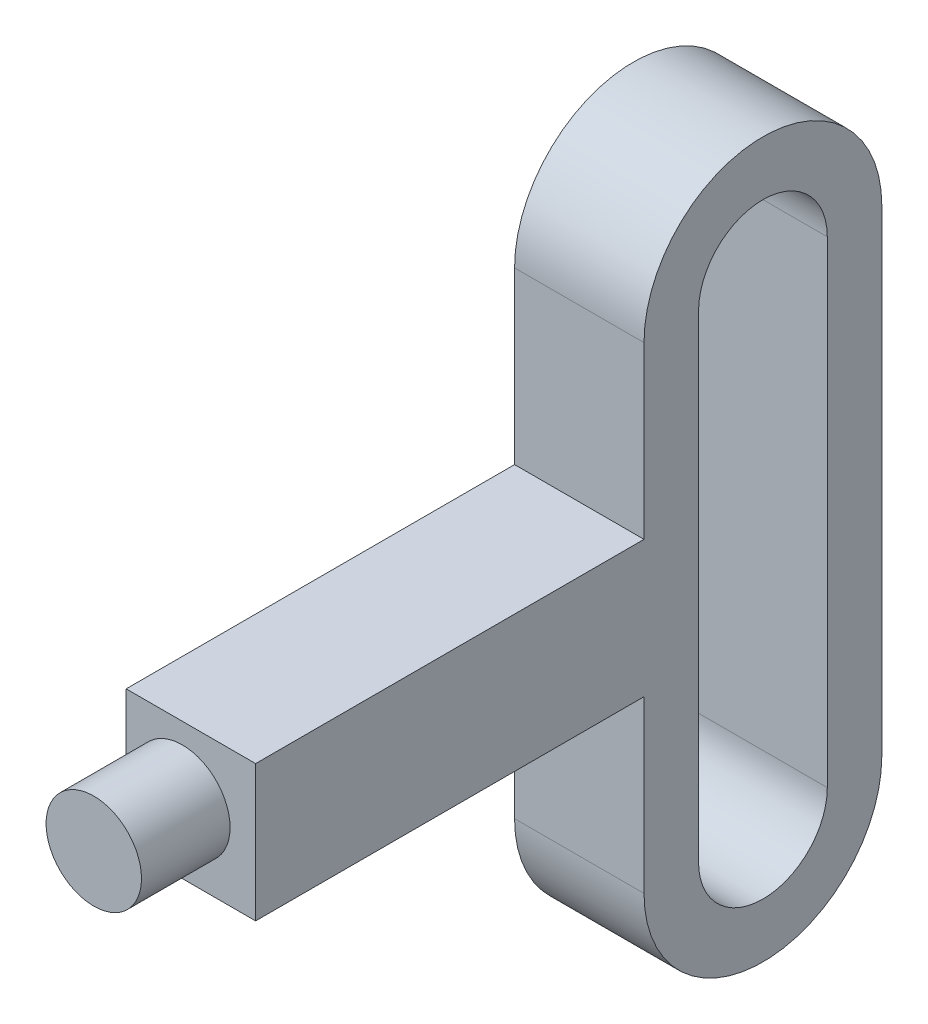
from build123d import *

# Parameters (mm, degrees)
BOSS_EXTRUDE2_DEPTH = 24.13
SKETCH3_W           = 24.13
SKETCH3_H           = 25.4
SKETCH3_R           = 8.89
CUT_EXTRUDE3_DEPTH  = 16.51


with BuildPart() as part:
    # Sketch2 → Boss-Extrude2 (new body)
    with BuildSketch(Plane(origin=(0, 0, 0), x_dir=(0, 0, -1), z_dir=(1, 0, 0))):
        with BuildLine():
            Line((-22.16, -12.7), (-22.16, -44.45))
            ThreePointArc((-22.16, -44.45), (0, -66.61), (22.16, -44.45))
            Line((22.16, -44.45), (22.16, 44.45))
            ThreePointArc((22.16, 44.45), (0, 66.61), (-22.16, 44.45))
            Line((-22.16, 44.45), (-22.16, 12.7))
            Line((-22.16, 12.7), (-111.06, 12.7))
            Line((-111.06, 12.7), (-111.06, -12.7))
            Line((-111.06, -12.7), (-22.16, -12.7))
        make_face()
        with BuildLine():
            ThreePointArc((12, -44.45), (0, -56.45), (-12, -44.45))
            Line((-12, -44.45), (-12, 44.45))
            ThreePointArc((-12, 44.45), (0, 56.45), (12, 44.45))
            Line((12, 44.45), (12, -44.45))
        make_face(mode=Mode.SUBTRACT)
    extrude(amount=BOSS_EXTRUDE2_DEPTH)

    # Sketch3 → Cut-Extrude3 (cut)
    with BuildSketch(Plane.XY.offset(111.06)):
        with Locations((12.065, 0)):
            Rectangle(SKETCH3_W, SKETCH3_H)
        with Locations((10.4775, 0)):
            Circle(SKETCH3_R, mode=Mode.SUBTRACT)
    extrude(amount=-CUT_EXTRUDE3_DEPTH, mode=Mode.SUBTRACT)


solid = part.part
